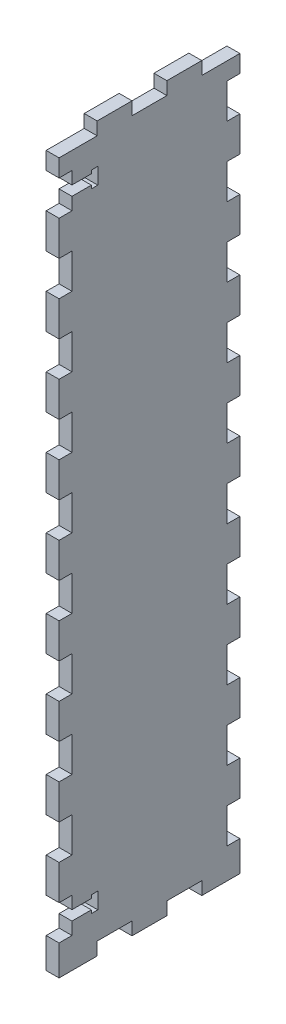
from build123d import *

# Parameters (mm, degrees)
BOSS_EXTRUDE1_DEPTH = 6.35


with BuildPart() as part:
    # Sketch1 → Boss-Extrude1 (new body)
    with BuildSketch(Plane(origin=(0, 0, 0), x_dir=(0, 0, -1), z_dir=(1, 0, 0))):
        Polygon((0, 14.9225), (0, 6.35), (0, 0), (6.35, 0), (18.7325, 0), (18.7325, 6.35), (35.8775, 6.35), (35.8775, 0), (53.0225, 0), (53.0225, 6.35), (70.1675, 6.35), (70.1675, 0), (82.55, 0), (88.9, 0), (88.9, 6.35), (88.9, 14.9225), (82.55, 14.9225), (82.55, 32.0675), (88.9, 32.0675), (88.9, 49.2125), (82.55, 49.2125), (82.55, 66.3575), (88.9, 66.3575), (88.9, 83.5025), (82.55, 83.5025), (82.55, 100.6475), (88.9, 100.6475), (88.9, 117.7925), (82.55, 117.7925), (82.55, 134.9375), (88.9, 134.9375), (88.9, 152.0825), (82.55, 152.0825), (82.55, 169.2275), (88.9, 169.2275), (88.9, 186.3725), (82.55, 186.3725), (82.55, 203.5175), (88.9, 203.5175), (88.9, 220.6625), (82.55, 220.6625), (82.55, 237.8075), (88.9, 237.8075), (88.9, 254.9525), (82.55, 254.9525), (82.55, 272.0975), (88.9, 272.0975), (88.9, 289.2425), (82.55, 289.2425), (82.55, 306.3875), (88.9, 306.3875), (88.9, 323.5325), (82.55, 323.5325), (82.55, 340.6775), (88.9, 340.6775), (88.9, 349.25), (70.1675, 349.25), (70.1675, 355.6), (53.0225, 355.6), (53.0225, 349.25), (35.8775, 349.25), (35.8775, 355.6), (18.7325, 355.6), (18.7325, 349.25), (6.35, 349.25), (0, 349.25), (0, 340.6775), (6.35, 340.6775), (6.35, 334.518000001), (15.875, 334.518000001), (15.875, 336.105000001), (19.05, 336.105000001), (19.05, 328.105000001), (15.875, 328.105000001), (15.875, 329.692000001), (6.35, 329.692000001), (6.35, 323.5325), (0, 323.5325), (0, 306.3875), (6.35, 306.3875), (6.35, 289.2425), (0, 289.2425), (0, 272.0975), (6.35, 272.0975), (6.35, 254.9525), (0, 254.9525), (0, 237.8075), (6.35, 237.8075), (6.35, 220.6625), (0, 220.6625), (0, 203.5175), (6.35, 203.5175), (6.35, 186.3725), (0, 186.3725), (0, 169.2275), (6.35, 169.2275), (6.35, 152.0825), (0, 152.0825), (0, 134.9375), (6.35, 134.9375), (6.35, 117.7925), (0, 117.7925), (0, 100.6475), (6.35, 100.6475), (6.35, 83.5025), (0, 83.5025), (0, 66.3575), (6.35, 66.3575), (6.35, 49.2125), (0, 49.2125), (0, 32.0675), (6.35, 32.0675), (6.35, 25.907999999), (15.875, 25.907999999), (15.875, 27.494999999), (19.05, 27.494999999), (19.05, 19.494999999), (15.875, 19.494999999), (15.875, 21.081999999), (6.35, 21.081999999), (6.35, 14.9225), align=None)
    extrude(amount=BOSS_EXTRUDE1_DEPTH)


solid = part.part
